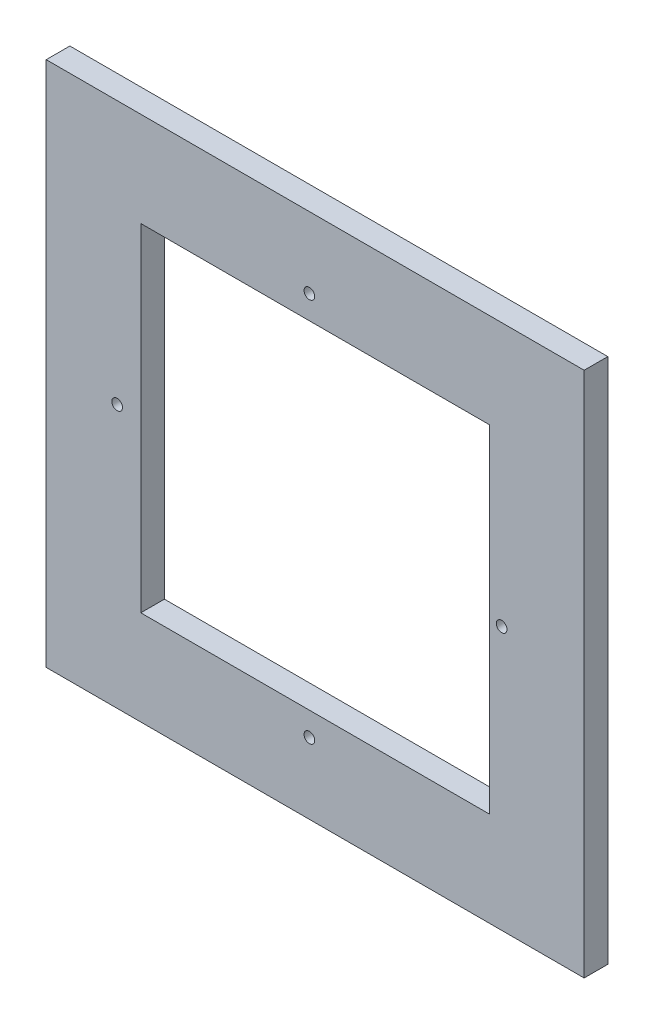
from build123d import *

# Parameters (mm, degrees)
SKETCH1_W           = 144.461353509
SKETCH1_H           = 141.351
SKETCH1_W_2         = 93.661353509
SKETCH1_H_2         = 90.551
SKETCH1_R           = 1.4351
BOSS_EXTRUDE4_DEPTH = 6.35


with BuildPart() as part:
    # Sketch1 → Boss-Extrude4 (new body)
    with BuildSketch(Plane.XY):
        with Locations((1.555176755, 0)):
            Rectangle(SKETCH1_W, SKETCH1_H)
        with Locations((1.555176754, 0)):
            Rectangle(SKETCH1_W_2, SKETCH1_H_2, mode=Mode.SUBTRACT)
        with Locations((0, 51.6255)):
            Circle(SKETCH1_R, mode=Mode.SUBTRACT)
        with Locations((51.6255, 0)):
            Circle(SKETCH1_R, mode=Mode.SUBTRACT)
        with Locations((-51.6255, 0)):
            Circle(SKETCH1_R, mode=Mode.SUBTRACT)
        with Locations((0, -51.6255)):
            Circle(SKETCH1_R, mode=Mode.SUBTRACT)
    extrude(amount=BOSS_EXTRUDE4_DEPTH)


solid = part.part
